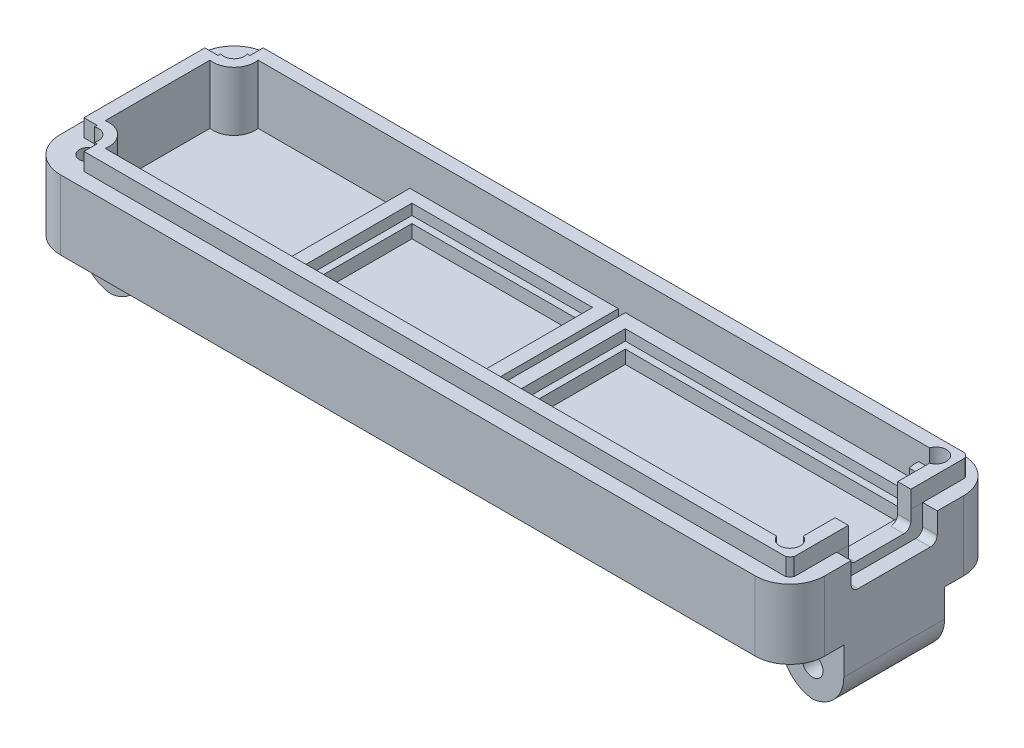
from build123d import *

# Parameters (mm, degrees)
SKETCH1_W           = 110
SKETCH1_H           = 30
BOSS_EXTRUDE1_DEPTH = 10
SHELL1_T            = -4
SKETCH2_W           = 30
SKETCH2_H           = 22.6
SKETCH2_W_2         = 26
SKETCH2_H_2         = 18.6
SKETCH2_W_3         = 47.2
SKETCH2_H_3         = 22
SKETCH2_W_4         = 43.2
SKETCH2_H_4         = 18
BOSS_EXTRUDE2_DEPTH = 3.45
SKETCH3_W           = 26
SKETCH3_H           = 18.6
SKETCH3_W_2         = 24
SKETCH3_H_2         = 16.6
SKETCH3_W_3         = 43.2
SKETCH3_H_3         = 18
SKETCH3_W_4         = 41.2
SKETCH3_H_4         = 16
BOSS_EXTRUDE3_DEPTH = 1.91
BOSS_EXTRUDE4_REACH = 65.07
SKETCH4_R           = 3
SKETCH4_R_2         = 1.5
CUT_EXTRUDE4_REACH  = 65.07
SKETCH5_R           = 1.25
BOSS_EXTRUDE5_START = 2.5
BOSS_EXTRUDE5_DEPTH = 2.5
CUT_EXTRUDE7_DEPTH  = 3
CUT_EXTRUDE8_START  = -5.05
SKETCH9_W           = 11.612420809
SKETCH9_H           = 9
CUT_EXTRUDE8_DEPTH  = 5.05
SKETCH10_W          = 2.105051461
SKETCH10_H          = 12.390469158
CUT_EXTRUDE9_DEPTH  = 4
FILLET1_R           = 5
FILLET2_R           = 1
SKETCH11_W          = 9
SKETCH11_H          = 14.5
BOSS_EXTRUDE6_DEPTH = 9
SKETCH12_R          = 1.5
CUT_EXTRUDE10_DEPTH = 14.5
FILLET3_R           = 5


with BuildPart() as part:
    # Sketch1 → Boss-Extrude1 (new body)
    with BuildSketch(Plane(origin=(0, 0, 0), x_dir=(1, 0, 0), z_dir=(0, 1, 0))):
        with Locations((4.231484391, 4.222107765)):
            Rectangle(SKETCH1_W, SKETCH1_H)
    extrude(amount=BOSS_EXTRUDE1_DEPTH)

    # Shell1
    shell1_openings = [part.faces().sort_by_distance(p)[0] for p in [
        (4.231484391, 10, -4.222107765),
    ]]
    offset(amount=SHELL1_T, openings=shell1_openings, kind=Kind.INTERSECTION)

    # Sketch2 → Boss-Extrude2 (add)
    # profile 1 of 2: a face of its own
    with BuildSketch(Plane(origin=(0, 4, 0), x_dir=(1, 0, 0), z_dir=(0, 1, 0))):
        with Locations((-6.468515609, 4.222107765)):
            Rectangle(SKETCH2_W, SKETCH2_H)
        with Locations((-6.468515609, 4.222107765)):
            Rectangle(SKETCH2_W_2, SKETCH2_H_2, mode=Mode.SUBTRACT)
    # profile 2 of 2: a face of its own
    with BuildSketch(Plane(origin=(0, 4, 0), x_dir=(1, 0, 0), z_dir=(0, 1, 0))):
        with Locations((33.131484391, 4.222107765)):
            Rectangle(SKETCH2_W_3, SKETCH2_H_3)
        with Locations((33.131484391, 4.222107765)):
            Rectangle(SKETCH2_W_4, SKETCH2_H_4, mode=Mode.SUBTRACT)
    extrude(amount=BOSS_EXTRUDE2_DEPTH)

    # Sketch3 → Boss-Extrude3 (add)
    # profile 1 of 2: a face of its own
    with BuildSketch(Plane(origin=(0, 4, 0), x_dir=(1, 0, 0), z_dir=(0, 1, 0))):
        with Locations((-6.468515609, 4.222107765)):
            Rectangle(SKETCH3_W, SKETCH3_H)
        with Locations((-6.468515609, 4.222107765)):
            Rectangle(SKETCH3_W_2, SKETCH3_H_2, mode=Mode.SUBTRACT)
    # profile 2 of 2: a face of its own
    with BuildSketch(Plane(origin=(0, 4, 0), x_dir=(1, 0, 0), z_dir=(0, 1, 0))):
        with Locations((33.131484391, 4.222107765)):
            Rectangle(SKETCH3_W_3, SKETCH3_H_3)
        with Locations((33.131484391, 4.222107765)):
            Rectangle(SKETCH3_W_4, SKETCH3_H_4, mode=Mode.SUBTRACT)
    extrude(amount=BOSS_EXTRUDE3_DEPTH)

    # Boss-Extrude4: up to this face of the body (flat: up to its plane)
    boss_extrude4_end = Plane(part.part.faces().sort_by_distance((-34.118515609, 4, -4.222107765))[0])
    # Sketch4 → Boss-Extrude4 (add, up to the picked face)
    with BuildSketch(Plane(origin=(0, 10, 0), x_dir=(1, 0, 0), z_dir=(0, 1, 0)), mode=Mode.PRIVATE) as boss_extrude4_sk1:
        with Locations((-46.268515609, -6.277892235)):
            Circle(SKETCH4_R)
        with Locations((-46.268515609, -6.277892235)):
            Circle(SKETCH4_R_2, mode=Mode.SUBTRACT)
    boss_extrude4_tool1 = split(extrude(boss_extrude4_sk1.sketch, amount=-BOSS_EXTRUDE4_REACH, mode=Mode.PRIVATE), bisect_by=boss_extrude4_end, keep=Keep.BOTH, mode=Mode.PRIVATE)
    # Sketch4 → Boss-Extrude4 (add, up to the picked face)
    with BuildSketch(Plane(origin=(0, 10, 0), x_dir=(1, 0, 0), z_dir=(0, 1, 0)), mode=Mode.PRIVATE) as boss_extrude4_sk2:
        with Locations((-46.268515609, 14.722107765)):
            Circle(SKETCH4_R)
        with Locations((-46.268515609, 14.722107765)):
            Circle(SKETCH4_R_2, mode=Mode.SUBTRACT)
    boss_extrude4_tool2 = split(extrude(boss_extrude4_sk2.sketch, amount=-BOSS_EXTRUDE4_REACH, mode=Mode.PRIVATE), bisect_by=boss_extrude4_end, keep=Keep.BOTH, mode=Mode.PRIVATE)
    # Sketch4 → Boss-Extrude4 (add, up to the picked face)
    with BuildSketch(Plane(origin=(0, 10, 0), x_dir=(1, 0, 0), z_dir=(0, 1, 0)), mode=Mode.PRIVATE) as boss_extrude4_sk3:
        with BuildLine():
            Line((55.231484391, 11.764067874), (55.231484391, 13.307894203))
            ThreePointArc((55.231484391, 13.307894203), (55.103485361, 16.175247565), (53.613450402, 13.722107765))
            Line((53.613450402, 13.722107765), (51.903057266, 13.722107765))
            ThreePointArc((51.903057266, 13.722107765), (56.252626486, 17.307862341), (55.231484391, 11.764067874))
        make_face()
    boss_extrude4_tool3 = split(extrude(boss_extrude4_sk3.sketch, amount=-BOSS_EXTRUDE4_REACH, mode=Mode.PRIVATE), bisect_by=boss_extrude4_end, keep=Keep.BOTH, mode=Mode.PRIVATE)
    # Sketch4 → Boss-Extrude4 (add, up to the picked face)
    with BuildSketch(Plane(origin=(0, 10, 0), x_dir=(1, 0, 0), z_dir=(0, 1, 0)), mode=Mode.PRIVATE) as boss_extrude4_sk4:
        with BuildLine():
            Line((51.903057266, -5.277892235), (53.613450402, -5.277892235))
            ThreePointArc((53.613450402, -5.277892235), (55.103485361, -7.731032035), (55.231484391, -4.863678672))
            Line((55.231484391, -4.863678672), (55.231484391, -3.319852343))
            ThreePointArc((55.231484391, -3.319852343), (56.252626486, -8.86364681), (51.903057266, -5.277892235))
        make_face()
    boss_extrude4_tool4 = split(extrude(boss_extrude4_sk4.sketch, amount=-BOSS_EXTRUDE4_REACH, mode=Mode.PRIVATE), bisect_by=boss_extrude4_end, keep=Keep.BOTH, mode=Mode.PRIVATE)
    add(boss_extrude4_tool1.solids().sort_by(Axis((-49.183663, 10, 6.277892), (0, -1, 0)))[0])
    add(boss_extrude4_tool2.solids().sort_by(Axis((-49.183663, 10, -14.722108), (0, -1, 0)))[0])
    add(boss_extrude4_tool3.solids().sort_by(Axis((56.209752, 10, -17.234981), (0, -1, 0)))[0])
    add(boss_extrude4_tool4.solids().sort_by(Axis((52.758254, 10, 5.362449), (0, -1, 0)))[0])

    # Cut-Extrude4: up to this face of the body (flat: up to its plane)
    cut_extrude4_end = Plane(part.part.faces().sort_by_distance((4.231484391, 0, -4.222107765))[0])
    # Sketch5 → Cut-Extrude4 (cut, up to the picked face)
    with BuildSketch(Plane(origin=(0, 10, 0), x_dir=(1, 0, 0), z_dir=(0, 1, 0)), mode=Mode.PRIVATE) as cut_extrude4_sk1:
        with Locations(Location((-46.268515609, 14.722107765, 0), (0, 0, 270))):
            Circle(SKETCH5_R)
    cut_extrude4_tool1 = split(extrude(cut_extrude4_sk1.sketch, amount=-CUT_EXTRUDE4_REACH, mode=Mode.PRIVATE), bisect_by=cut_extrude4_end, keep=Keep.BOTH, mode=Mode.PRIVATE)
    # Sketch5 → Cut-Extrude4 (cut, up to the picked face)
    with BuildSketch(Plane(origin=(0, 10, 0), x_dir=(1, 0, 0), z_dir=(0, 1, 0)), mode=Mode.PRIVATE) as cut_extrude4_sk2:
        with Locations(Location((-46.268515609, -6.277892235, 0), (0, 0, 270))):
            Circle(SKETCH5_R)
    cut_extrude4_tool2 = split(extrude(cut_extrude4_sk2.sketch, amount=-CUT_EXTRUDE4_REACH, mode=Mode.PRIVATE), bisect_by=cut_extrude4_end, keep=Keep.BOTH, mode=Mode.PRIVATE)
    # Sketch5 → Cut-Extrude4 (cut, up to the picked face)
    with BuildSketch(Plane(origin=(0, 10, 0), x_dir=(1, 0, 0), z_dir=(0, 1, 0)), mode=Mode.PRIVATE) as cut_extrude4_sk3:
        with Locations(Location((54.731484391, -6.277892235, 0), (0, 0, 270))):
            Circle(SKETCH5_R)
    cut_extrude4_tool3 = split(extrude(cut_extrude4_sk3.sketch, amount=-CUT_EXTRUDE4_REACH, mode=Mode.PRIVATE), bisect_by=cut_extrude4_end, keep=Keep.BOTH, mode=Mode.PRIVATE)
    # Sketch5 → Cut-Extrude4 (cut, up to the picked face)
    with BuildSketch(Plane(origin=(0, 10, 0), x_dir=(1, 0, 0), z_dir=(0, 1, 0)), mode=Mode.PRIVATE) as cut_extrude4_sk4:
        with Locations(Location((54.731484391, 14.722107765, 0), (0, 0, 270))):
            Circle(SKETCH5_R)
    cut_extrude4_tool4 = split(extrude(cut_extrude4_sk4.sketch, amount=-CUT_EXTRUDE4_REACH, mode=Mode.PRIVATE), bisect_by=cut_extrude4_end, keep=Keep.BOTH, mode=Mode.PRIVATE)
    add(cut_extrude4_tool1.solids().sort_by(Axis((-46.268516, 10, -14.722108), (0, -1, 0)))[0], mode=Mode.SUBTRACT)
    add(cut_extrude4_tool2.solids().sort_by(Axis((-46.268516, 10, 6.277892), (0, -1, 0)))[0], mode=Mode.SUBTRACT)
    add(cut_extrude4_tool3.solids().sort_by(Axis((54.731484, 10, 6.277892), (0, -1, 0)))[0], mode=Mode.SUBTRACT)
    add(cut_extrude4_tool4.solids().sort_by(Axis((54.731484, 10, -14.722108), (0, -1, 0)))[0], mode=Mode.SUBTRACT)

    # Sketch7 → Boss-Extrude5 (add)
    with BuildSketch(Plane(origin=(0, 10, 0), x_dir=(1, 0, 0), z_dir=(0, 1, 0)).offset(BOSS_EXTRUDE5_START)):
        with BuildLine():
            ThreePointArc((-44.854302047, 15.222107765), (-45.207855437, 13.661447594), (-46.768515609, 13.307894203))
            Line((-46.768515609, 13.307894203), (-46.768515609, 12.922107765))
            Line((-46.768515609, 12.922107765), (-48.668515609, 12.922107765))
            Line((-48.668515609, 12.922107765), (-48.668515609, -3.319852343))
            Line((-48.668515609, -3.319852343), (-48.668515609, -4.477892235))
            Line((-48.668515609, -4.477892235), (-46.768515609, -4.477892235))
            Line((-46.768515609, -4.477892235), (-46.768515609, -4.863678672))
            ThreePointArc((-46.768515609, -4.863678672), (-45.207855437, -5.217232063), (-44.854302047, -6.777892235))
            Line((-44.854302047, -6.777892235), (-44.468515609, -6.777892235))
            Line((-44.468515609, -6.777892235), (-44.468515609, -8.677892235))
            Line((-44.468515609, -8.677892235), (-43.310475718, -8.677892235))
            Line((-43.310475718, -8.677892235), (51.773444499, -8.677892235))
            Line((51.773444499, -8.677892235), (52.931484391, -8.677892235))
            Line((52.931484391, -8.677892235), (56.531484391, -8.677892235))
            ThreePointArc((56.531484391, -8.677892235), (56.852804734, -8.399212578), (57.131484391, -8.077892235))
            Line((57.131484391, -8.077892235), (57.131484391, -5.132248311))
            Line((57.131484391, -5.132248311), (57.131484391, 13.576463842))
            Line((57.131484391, 13.576463842), (57.131484391, 16.522107765))
            ThreePointArc((57.131484391, 16.522107765), (56.852804734, 16.843428109), (56.531484391, 17.122107765))
            Line((56.531484391, 17.122107765), (51.773444499, 17.122107765))
            Line((51.773444499, 17.122107765), (-44.468515609, 17.122107765))
            Line((-44.468515609, 17.122107765), (-44.468515609, 15.222107765))
            Line((-44.468515609, 15.222107765), (-44.854302047, 15.222107765))
        make_face()
        with BuildLine():
            Line((53.317270829, -6.777892235), (51.773444499, -6.777892235))
            Line((51.773444499, -6.777892235), (-43.310475718, -6.777892235))
            ThreePointArc((-43.310475718, -6.777892235), (-44.147195266, -4.156571891), (-46.768515609, -3.319852343))
            Line((-46.768515609, -3.319852343), (-46.768515609, 11.764067874))
            ThreePointArc((-46.768515609, 11.764067874), (-44.147195266, 12.600787422), (-43.310475718, 15.222107765))
            Line((-43.310475718, 15.222107765), (51.773444499, 15.222107765))
            Line((51.773444499, 15.222107765), (53.317270829, 15.222107765))
            ThreePointArc((53.317270829, 15.222107765), (55.792144563, 15.782767937), (55.231484391, 13.307894203))
            Line((55.231484391, 13.307894203), (55.231484391, -4.863678672))
            ThreePointArc((55.231484391, -4.863678672), (55.792144563, -7.338552406), (53.317270829, -6.777892235))
        make_face(mode=Mode.SUBTRACT)
    extrude(amount=-BOSS_EXTRUDE5_DEPTH)

    # Sketch8 → Cut-Extrude7 (cut)
    with BuildSketch(Plane.XZ):
        Polygon((-43.518515609, -13.134394525), (-43.518515609, -16.309821006), (-46.268515609, -17.897534246), (-49.018515609, -16.309821006), (-49.018515609, -13.134394525), (-46.268515609, -11.546681285), align=None)
        Polygon((-43.518515609, 7.865605475), (-46.268515609, 9.453318715), (-49.018515609, 7.865605475), (-49.018515609, 4.690178994), (-46.268515609, 3.102465754), (-43.518515609, 4.690178994), align=None)
        Polygon((51.981484391, -16.309821006), (54.731484391, -17.897534246), (57.481484391, -16.309821006), (57.481484391, -13.134394525), (54.731484391, -11.546681285), (51.981484391, -13.134394525), align=None)
        Polygon((51.981484391, 4.690178994), (51.981484391, 7.865605475), (54.731484391, 9.453318715), (57.481484391, 7.865605475), (57.481484391, 4.690178994), (54.731484391, 3.102465754), align=None)
    extrude(amount=-CUT_EXTRUDE7_DEPTH, mode=Mode.SUBTRACT)

    # Sketch9 → Cut-Extrude8 (cut)
    with BuildSketch(Plane(origin=(0, 12.5, 0), x_dir=(1, 0, 0), z_dir=(0, 1, 0)).offset(CUT_EXTRUDE8_START)):
        with Locations((57.937694796, 4.222107765)):
            Rectangle(SKETCH9_W, SKETCH9_H)
    extrude(amount=CUT_EXTRUDE8_DEPTH, mode=Mode.SUBTRACT)

    # Sketch10 → Cut-Extrude9 (cut)
    with BuildSketch(Plane(origin=(0, 10, 0), x_dir=(1, 0, 0), z_dir=(0, 1, 0))):
        with Locations((58.178958661, 4.222107765)):
            Rectangle(SKETCH10_W, SKETCH10_H)
    extrude(amount=-CUT_EXTRUDE9_DEPTH, mode=Mode.SUBTRACT)

    # Fillet1
    fillet1_edges = [part.edges().sort_by_distance(p)[0] for p in [
        (-50.768515609, 5, -19.222107765),
        (59.231484391, 5, -19.222107765),
        (59.231484391, 5, 10.777892235),
        (-50.768515609, 5, 10.777892235),
    ]]
    fillet(fillet1_edges, radius=FILLET1_R)

    # Fillet2
    fillet2_edges = [part.edges().sort_by_distance(p)[0] for p in [
        (56.178958661, 7.45, 0.277892235),
        (56.178958661, 7.45, -8.722107765),
        (58.178958661, 6, 1.973126814),
        (58.178958661, 6, -10.417342344),
    ]]
    fillet(fillet2_edges, radius=FILLET2_R)

    # Sketch11 → Boss-Extrude6 (add)
    with BuildSketch(Plane(origin=(0, 0, 0), x_dir=(-1, 0, 0), z_dir=(0, -1, 0))):
        with Locations((-54.731484391, 4.222107765)):
            Rectangle(SKETCH11_W, SKETCH11_H)
        with Locations((46.268515609, 4.222107765)):
            Rectangle(SKETCH11_W, SKETCH11_H)
    extrude(amount=BOSS_EXTRUDE6_DEPTH)

    # Sketch12 → Cut-Extrude10 (cut)
    with BuildSketch(Plane.XY.offset(3.027892235)):
        with Locations((54.731484391, -4.75)):
            Circle(SKETCH12_R)
        with Locations((-46.268515609, -4.75)):
            Circle(SKETCH12_R)
    extrude(amount=-CUT_EXTRUDE10_DEPTH, mode=Mode.SUBTRACT)

    # Fillet3
    # the kernel refuses this fillet: 5 mm, written as the material it takes off along each edge
    with BuildSketch(Plane(origin=(-50.768515609, -9, 15.527892235), x_dir=(0, 1, 0), z_dir=(0, 0, -1)), Plane(origin=(50.231484391, -9, -23.972107765), x_dir=(1, 0, 0), z_dir=(0, 0, 1)), Plane(origin=(-41.768515609, -9, -23.972107765), x_dir=(0, 1, 0), z_dir=(0, 0, 1))) as fillet3_piece_1:
        with BuildLine():
            CenterArc((FILLET3_R, FILLET3_R), FILLET3_R, 180, 90)
            Line((0, FILLET3_R), (0, 0))
            Line((0, 0), (FILLET3_R, 0))
        make_face()
    extrude(amount=39.5, mode=Mode.SUBTRACT)
    with BuildSketch(Plane(origin=(59.231484391, -9, 15.527892235), x_dir=(0, 1, 0), z_dir=(0, 0, -1))) as fillet3_piece_2:
        with BuildLine():
            CenterArc((FILLET3_R, -FILLET3_R), FILLET3_R, 90, 90)
            Line((0, -FILLET3_R), (0, 0))
            Line((0, 0), (FILLET3_R, 0))
        make_face()
    extrude(amount=39.5, mode=Mode.SUBTRACT)


solid = part.part
